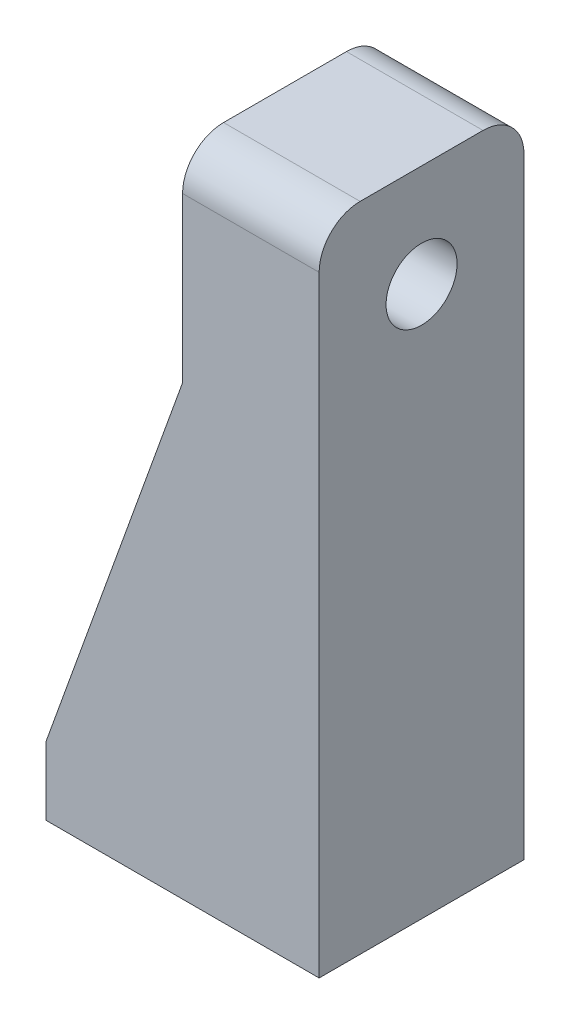
from build123d import *

# Parameters (mm, degrees)
SKETCH_1_W          = 20
SKETCH_1_H          = 5
EXTRUDE_1_DEPTH     = 15
FILLET_1_R          = 3
SKETCH_3_R          = 2.6
CUT_EXTRUDE_1_DEPTH = 50.523353077
SKETCH_9_R          = 4.5
SKETCH_9_R_2        = 3.5
CUT_EXTRUDE_2_DEPTH = 2
FILLET_2_R          = 1


with BuildPart() as part:
    # 草图1 → 凸台-拉伸1 (new body)
    with BuildSketch(Plane.XY):
        Polygon((-10, 27.75), (-20, 0), (0, 0), (0, 42.75), (-10, 42.75), align=None)
        with Locations((-10, -2.5)):
            Rectangle(SKETCH_1_W, SKETCH_1_H)
    extrude(amount=EXTRUDE_1_DEPTH)

    # 圆角1
    fillet_1_edges = [part.edges().sort_by_distance(p)[0] for p in [
        (-5, 42.75, 15),
        (-5, 42.75, 0),
    ]]
    fillet(fillet_1_edges, radius=FILLET_1_R)

    # 草图3 → 切除-拉伸1 (cut, through all)
    with BuildSketch(Plane(origin=(0, 0, 0), x_dir=(0, 0, -1), z_dir=(1, 0, 0))):
        with Locations((-7.5, 35.25)):
            Circle(SKETCH_3_R)
    extrude(amount=-CUT_EXTRUDE_1_DEPTH, mode=Mode.SUBTRACT)

    # 草图9 → 切除-拉伸2 (cut)
    with BuildSketch(Plane.ZY.offset(10)):
        with Locations(Location((7.5, 35.25, 0), (0, 0, 270))):
            Circle(SKETCH_9_R)
        with Locations(Location((7.5, 35.25, 0), (0, 0, 270))):
            Circle(SKETCH_9_R_2, mode=Mode.SUBTRACT)
    extrude(amount=-CUT_EXTRUDE_2_DEPTH, mode=Mode.SUBTRACT)

    # 圆角2
    # the kernel refuses this fillet: 1 mm, written as the material it takes off along each edge
    with BuildSketch(Plane(origin=(-10, 35.25, 7.5), x_dir=(0, 0, -1), z_dir=(0, -1, 0))) as fillet_2_piece_1:
        with BuildLine():
            CenterArc((3.6, 0.994987437), FILLET_2_R, 180, 84.260829523)
            Line((3.5, 0), (3.498, -0.019899749))
            ThreePointArc((3.498, -0.019899749), (3.05, -0.02), (2.6, -0.02))
            Line((2.6, -0.02), (2.58, 0))
            Line((2.58, 0), (2.58, 0.994987437))
            Line((2.58, 0.994987437), (2.6, 0.994987437))
        make_face()
    revolve(axis=Axis((-10, 35.25, 7.5), (1, 0, 0)), mode=Mode.SUBTRACT)


solid = part.part
